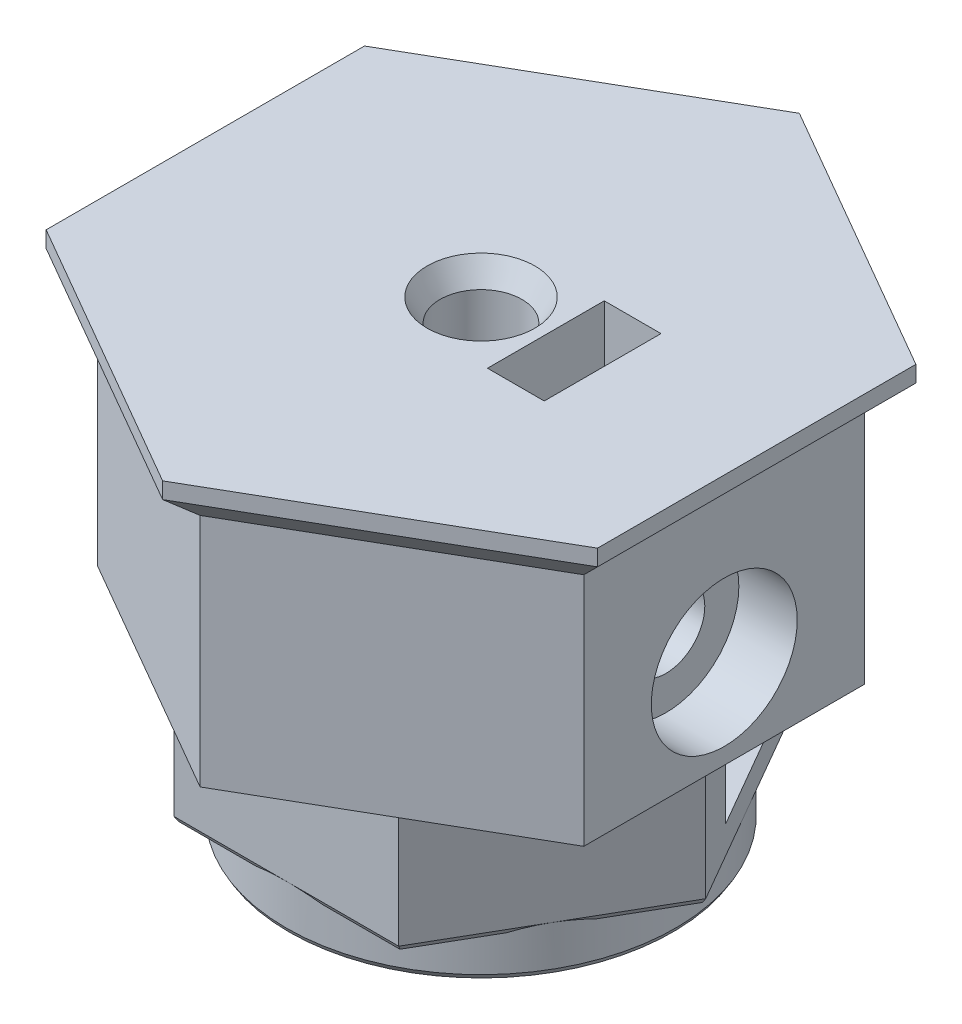
from build123d import *

# Parameters (mm, degrees)
SKIZZE1_R                       = 2.525
AUFSATZ_LINEAR_AUSTRAGEN1_DEPTH = 28
SKIZZE2_W                       = 3.5
SKIZZE2_H                       = 7.2
SCHNITT_LINEAR_AUSTRAGEN1_DEPTH = 16.2
SKIZZE4_R                       = 2.4
SCHNITT_LINEAR_AUSTRAGEN2_DEPTH = 16
SKIZZE6_R                       = 14.009035946
AUFSATZ_LINEAR_AUSTRAGEN3_DEPTH = 3
SKIZZE7_R                       = 20
SCHNITT_LINEAR_AUSTRAGEN4_DEPTH = 10.5
FASE1_SIZE                      = 0.8
FASE1_SIZE2                     = 1.385640646
SKIZZE9_W                       = 7.2
SKIZZE9_H                       = 3.5
SCHNITT_LINEAR_AUSTRAGEN5_DEPTH = 16
SKIZZE10_R                      = 8.5
SCHNITT_LINEAR_AUSTRAGEN6_DEPTH = 3
FASE2_SIZE                      = 2
SKIZZE11_R                      = 4.5
SCHNITT_LINEAR_AUSTRAGEN7_DEPTH = 3.6
SKIZZE12_R                      = 14.338361474
SKIZZE12_R_2                    = 12
SCHNITT_LINEAR_AUSTRAGEN8_DEPTH = 2.5
FASE3_SIZE                      = 0.3
FASE3_SIZE2                     = 0.173205081
FASE4_SIZE                      = 0.173205081
FASE4_SIZE_2                    = 0.3


# Some blends are built 0.0001 mm under size
with BuildPart() as part:
    # Skizze1 → Aufsatz-Linear austragen1 (new body)
    with BuildSketch(Plane(origin=(0, 0, 0), x_dir=(1, 0, 0), z_dir=(0, 1, 0))):
        Polygon((15, 8.660254038), (0, 17.320508076), (-15, 8.660254038), (-15, -8.660254038), (0, -17.320508076), (15, -8.660254038), align=None)
        with Locations(Location((0, 0, 0), (0, 0, 270))):
            Circle(SKIZZE1_R, mode=Mode.SUBTRACT)
    extrude(amount=AUFSATZ_LINEAR_AUSTRAGEN1_DEPTH)

    # Skizze2 → Schnitt-Linear austragen1 (cut)
    with BuildSketch(Plane(origin=(0, 28, 0), x_dir=(1, 0, 0), z_dir=(0, 1, 0))):
        with Locations((5.75, 0)):
            Rectangle(SKIZZE2_W, SKIZZE2_H)
    extrude(amount=-SCHNITT_LINEAR_AUSTRAGEN1_DEPTH, mode=Mode.SUBTRACT)

    # Skizze4 → Schnitt-Linear austragen2 (cut)
    with BuildSketch(Plane(origin=(15, 0, 0), x_dir=(0, 0, -1), z_dir=(1, 0, 0))):
        with Locations((0, 16)):
            Circle(SKIZZE4_R)
    extrude(amount=-SCHNITT_LINEAR_AUSTRAGEN2_DEPTH, mode=Mode.SUBTRACT)

    # Skizze6 → Aufsatz-Linear austragen3 (add)
    with BuildSketch(Plane(origin=(0, 28, 0), x_dir=(1, 0, 0), z_dir=(0, 1, 0))):
        Polygon((0, -19.629909152), (17, -9.814954576), (17, 9.814954576), (0, 19.629909152), (-17, 9.814954576), (-17, -9.814954576), align=None)
        Circle(SKIZZE6_R, mode=Mode.SUBTRACT)
    extrude(amount=-AUFSATZ_LINEAR_AUSTRAGEN3_DEPTH)

    # Skizze7 → Schnitt-Linear austragen4 (cut)
    with BuildSketch(Plane.XZ):
        Circle(SKIZZE7_R)
        Polygon((-6.92820323, 12), (-13.856406461, 0), (-6.92820323, -12), (6.92820323, -12), (13.856406461, 0), (6.92820323, 12), align=None, mode=Mode.SUBTRACT)
    extrude(amount=-SCHNITT_LINEAR_AUSTRAGEN4_DEPTH, mode=Mode.SUBTRACT)

    # Fase1
    fase1_edges = [part.edges().sort_by_distance(p)[0] for p in [
        (0, 28, -2.525),
    ]]
    fase1_side = [part.faces().sort_by_distance(p)[0] for p in [
        (0, 28, -3.044358579),
    ]]
    chamfer(fase1_edges, length=FASE1_SIZE, length2=FASE1_SIZE2, reference=fase1_side[0])

    # Skizze9 → Schnitt-Linear austragen5 (cut)
    with BuildSketch(Plane(origin=(10.392304845, 0, -6), x_dir=(-0.49999999999999983, 0, -0.8660254037844387), z_dir=(0.8660254037844387, 0, -0.49999999999999983))):
        with Locations((0, 6.25)):
            Rectangle(SKIZZE9_W, SKIZZE9_H)
    extrude(amount=-SCHNITT_LINEAR_AUSTRAGEN5_DEPTH, mode=Mode.SUBTRACT)

    # Skizze10 → Schnitt-Linear austragen6 (cut)
    with BuildSketch(Plane.XZ):
        with Locations(Location((0, 0, 0), (0, 0, 270))):
            Circle(SKIZZE10_R)
    extrude(amount=-SCHNITT_LINEAR_AUSTRAGEN6_DEPTH, mode=Mode.SUBTRACT)

    # Fase2
    fase2_edges = [part.edges().sort_by_distance(p)[0] for p in [
        (-8.5, 25, 14.722431864),
        (-17, 25, 0),
        (-8.5, 25, -14.722431864),
        (8.5, 25, -14.722431864),
        (17, 25, 0),
        (8.5, 25, 14.722431864),
    ]]
    chamfer(fase2_edges, length=FASE2_SIZE - 0.0001)  # a hair under: the kernel refuses the full size

    # Skizze11 → Schnitt-Linear austragen7 (cut)
    with BuildSketch(Plane(origin=(15, 0, 0), x_dir=(0, 0, -1), z_dir=(1, 0, 0))):
        with Locations((0, 16)):
            Circle(SKIZZE11_R)
    extrude(amount=-SCHNITT_LINEAR_AUSTRAGEN7_DEPTH, mode=Mode.SUBTRACT)

    # Skizze12 → Schnitt-Linear austragen8 (cut)
    with BuildSketch(Plane.XZ):
        Circle(SKIZZE12_R)
        with Locations(Location((0, 0, 0), (0, 0, 270))):
            Circle(SKIZZE12_R_2, mode=Mode.SUBTRACT)
    extrude(amount=-SCHNITT_LINEAR_AUSTRAGEN8_DEPTH, mode=Mode.SUBTRACT)

    # Fase3
    fase3_edges = [part.edges().sort_by_distance(p)[0] for p in [
        (0, 0, 12),
    ]]
    fase3_side = [part.faces().sort_by_distance(p)[0] for p in [
        (0, 1.25, 12),
    ]]
    chamfer(fase3_edges, length=FASE3_SIZE, length2=FASE3_SIZE2, reference=fase3_side[0])

    # Fase4
    # the kernel refuses this chamfer: 0.3, 0.173205081 mm, written as the material it takes off along each edge
    with BuildSketch(Plane(origin=(-10.392304845, 2.5, 6), x_dir=(0.864572857266567, -0.05789386240267096, -0.4991613718768963), z_dir=(0.5, 0, 0.8660254037844387))) as fase4_piece_1_section:
        Polygon((FASE4_SIZE * 0.998322742353, FASE4_SIZE * 0.0578938623214), (-FASE4_SIZE_2 * 0.0578938624027, FASE4_SIZE_2 * 0.998322743754), (0, 0), align=None)
    fase4_piece_1 = extrude(amount=7.704328957, mode=Mode.PRIVATE)
    fase4_piece_1 = fase4_piece_1 - Plane(origin=(0, 2.602492353, 0), x_dir=(0, 0, -1), z_dir=(0, -1, 0)) * Cylinder(12, 17, mode=Mode.PRIVATE)
    add(fase4_piece_1, mode=Mode.SUBTRACT)
    with BuildSketch(Plane(origin=(-14.244469324, 2.5, -0.672144596), x_dir=(0.864572857266567, -0.05789386240267102, -0.4991613718768963), z_dir=(0.5, 0, 0.8660254037844387))) as fase4_piece_2_section:
        Polygon((FASE4_SIZE * 0.998322742353, FASE4_SIZE * 0.0578938623214), (-FASE4_SIZE_2 * 0.0578938624027, FASE4_SIZE_2 * 0.998322743754), (0, 0), align=None)
    fase4_piece_2 = extrude(amount=7.704328957, mode=Mode.PRIVATE)
    fase4_piece_2 = fase4_piece_2 - Plane(origin=(0, 2.602492354, 0), x_dir=(0, 0, -1), z_dir=(0, -1, 0)) * Cylinder(12, 17, mode=Mode.PRIVATE)
    add(fase4_piece_2, mode=Mode.SUBTRACT)
    with BuildSketch(Plane(origin=(-7.704328957, 2.5, 12), x_dir=(0, -0.057893862402670936, -0.9983227437537926), z_dir=(1, 0, 0))) as fase4_piece_3_section:
        Polygon((FASE4_SIZE * 0.998322742353, FASE4_SIZE * 0.0578938623214), (-FASE4_SIZE_2 * 0.0578938624027, FASE4_SIZE_2 * 0.998322743754), (0, 0), align=None)
    fase4_piece_3 = extrude(amount=7.704328957, mode=Mode.PRIVATE)
    fase4_piece_3 = fase4_piece_3 - Plane(origin=(0, 2.602492354, 0), x_dir=(0, 0, -1), z_dir=(0, -1, 0)) * Cylinder(12, 17, mode=Mode.PRIVATE)
    add(fase4_piece_3, mode=Mode.SUBTRACT)
    with BuildSketch(Plane(origin=(0, 2.5, 12), x_dir=(0, -0.057893862402670936, -0.9983227437537926), z_dir=(1, 0, 0))) as fase4_piece_4_section:
        Polygon((FASE4_SIZE * 0.998322742353, FASE4_SIZE * 0.0578938623214), (-FASE4_SIZE_2 * 0.0578938624027, FASE4_SIZE_2 * 0.998322743754), (0, 0), align=None)
    fase4_piece_4 = extrude(amount=7.704328957, mode=Mode.PRIVATE)
    fase4_piece_4 = fase4_piece_4 - Plane(origin=(0, 2.602492353, 0), x_dir=(0, 0, -1), z_dir=(0, -1, 0)) * Cylinder(12, 17, mode=Mode.PRIVATE)
    add(fase4_piece_4, mode=Mode.SUBTRACT)
    with BuildSketch(Plane(origin=(6.540140367, 2.5, 12.672144596), x_dir=(-0.864572857266567, -0.05789386240267135, -0.49916137187689613), z_dir=(0.4999999999999999, 0, -0.8660254037844388))) as fase4_piece_5_section:
        Polygon((FASE4_SIZE * 0.998322742353, FASE4_SIZE * 0.0578938623214), (-FASE4_SIZE_2 * 0.0578938624027, FASE4_SIZE_2 * 0.998322743754), (0, 0), align=None)
    fase4_piece_5 = extrude(amount=7.704328957, mode=Mode.PRIVATE)
    fase4_piece_5 = fase4_piece_5 - Plane(origin=(0, 2.602492354, 0), x_dir=(0, 0, -1), z_dir=(0, -1, 0)) * Cylinder(12, 17, mode=Mode.PRIVATE)
    add(fase4_piece_5, mode=Mode.SUBTRACT)
    with BuildSketch(Plane(origin=(10.392304845, 2.5, 6), x_dir=(-0.864572857266567, -0.05789386240267096, -0.49916137187689613), z_dir=(0.4999999999999999, 0, -0.8660254037844388))) as fase4_piece_6_section:
        Polygon((FASE4_SIZE * 0.998322742353, FASE4_SIZE * 0.0578938623214), (-FASE4_SIZE_2 * 0.0578938624027, FASE4_SIZE_2 * 0.998322743754), (0, 0), align=None)
    fase4_piece_6 = extrude(amount=7.704328957, mode=Mode.PRIVATE)
    fase4_piece_6 = fase4_piece_6 - Plane(origin=(0, 2.602492353, 0), x_dir=(0, 0, -1), z_dir=(0, -1, 0)) * Cylinder(12, 17, mode=Mode.PRIVATE)
    add(fase4_piece_6, mode=Mode.SUBTRACT)
    with BuildSketch(Plane(origin=(14.244469324, 2.5, 0.672144596), x_dir=(-0.8645728572665671, -0.05789386240267102, 0.49916137187689597), z_dir=(-0.49999999999999967, 0, -0.8660254037844388))) as fase4_piece_7_section:
        Polygon((FASE4_SIZE * 0.998322742353, FASE4_SIZE * 0.0578938623214), (-FASE4_SIZE_2 * 0.0578938624027, FASE4_SIZE_2 * 0.998322743754), (0, 0), align=None)
    fase4_piece_7 = extrude(amount=7.704328957, mode=Mode.PRIVATE)
    fase4_piece_7 = fase4_piece_7 - Plane(origin=(0, 2.602492354, 0), x_dir=(0, 0, -1), z_dir=(0, -1, 0)) * Cylinder(12, 17, mode=Mode.PRIVATE)
    add(fase4_piece_7, mode=Mode.SUBTRACT)
    with BuildSketch(Plane(origin=(10.392304845, 2.5, -6), x_dir=(-0.8645728572665671, -0.05789386240267096, 0.499161371876896), z_dir=(-0.49999999999999967, 0, -0.8660254037844388))) as fase4_piece_8_section:
        Polygon((FASE4_SIZE * 0.998322742353, FASE4_SIZE * 0.0578938623214), (-FASE4_SIZE_2 * 0.0578938624027, FASE4_SIZE_2 * 0.998322743754), (0, 0), align=None)
    fase4_piece_8 = extrude(amount=7.704328957, mode=Mode.PRIVATE)
    fase4_piece_8 = fase4_piece_8 - Plane(origin=(0, 2.602492353, 0), x_dir=(0, 0, -1), z_dir=(0, -1, 0)) * Cylinder(12, 17, mode=Mode.PRIVATE)
    add(fase4_piece_8, mode=Mode.SUBTRACT)
    with BuildSketch(Plane(origin=(7.704328957, 2.5, -12), x_dir=(0, -0.057893862402670936, 0.9983227437537926), z_dir=(-1, 0, 0))) as fase4_piece_9_section:
        Polygon((FASE4_SIZE * 0.998322742353, FASE4_SIZE * 0.0578938623214), (-FASE4_SIZE_2 * 0.0578938624027, FASE4_SIZE_2 * 0.998322743754), (0, 0), align=None)
    fase4_piece_9 = extrude(amount=7.704328957, mode=Mode.PRIVATE)
    fase4_piece_9 = fase4_piece_9 - Plane(origin=(0, 2.602492354, 0), x_dir=(0, 0, -1), z_dir=(0, -1, 0)) * Cylinder(12, 17, mode=Mode.PRIVATE)
    add(fase4_piece_9, mode=Mode.SUBTRACT)
    with BuildSketch(Plane(origin=(0, 2.5, -12), x_dir=(0, -0.057893862402670936, 0.9983227437537926), z_dir=(-1, 0, 0))) as fase4_piece_10_section:
        Polygon((FASE4_SIZE * 0.998322742353, FASE4_SIZE * 0.0578938623214), (-FASE4_SIZE_2 * 0.0578938624027, FASE4_SIZE_2 * 0.998322743754), (0, 0), align=None)
    fase4_piece_10 = extrude(amount=7.704328957, mode=Mode.PRIVATE)
    fase4_piece_10 = fase4_piece_10 - Plane(origin=(0, 2.602492354, 0), x_dir=(0, 0, -1), z_dir=(0, -1, 0)) * Cylinder(12, 17, mode=Mode.PRIVATE)
    add(fase4_piece_10, mode=Mode.SUBTRACT)
    with BuildSketch(Plane(origin=(-6.540140367, 2.5, -12.672144596), x_dir=(0.864572857266567, -0.05789386240267136, 0.49916137187689624), z_dir=(-0.4999999999999999, 0, 0.8660254037844387))) as fase4_piece_11_section:
        Polygon((FASE4_SIZE * 0.998322742353, FASE4_SIZE * 0.0578938623214), (-FASE4_SIZE_2 * 0.0578938624027, FASE4_SIZE_2 * 0.998322743754), (0, 0), align=None)
    fase4_piece_11 = extrude(amount=7.704328957, mode=Mode.PRIVATE)
    fase4_piece_11 = fase4_piece_11 - Plane(origin=(0, 2.602492354, 0), x_dir=(0, 0, -1), z_dir=(0, -1, 0)) * Cylinder(12, 17, mode=Mode.PRIVATE)
    add(fase4_piece_11, mode=Mode.SUBTRACT)
    with BuildSketch(Plane(origin=(-10.392304845, 2.5, -6), x_dir=(0.864572857266567, -0.05789386240267096, 0.49916137187689624), z_dir=(-0.4999999999999999, 0, 0.8660254037844387))) as fase4_piece_12_section:
        Polygon((FASE4_SIZE * 0.998322742353, FASE4_SIZE * 0.0578938623214), (-FASE4_SIZE_2 * 0.0578938624027, FASE4_SIZE_2 * 0.998322743754), (0, 0), align=None)
    fase4_piece_12 = extrude(amount=7.704328957, mode=Mode.PRIVATE)
    fase4_piece_12 = fase4_piece_12 - Plane(origin=(0, 2.602492353, 0), x_dir=(0, 0, -1), z_dir=(0, -1, 0)) * Cylinder(12, 17, mode=Mode.PRIVATE)
    add(fase4_piece_12, mode=Mode.SUBTRACT)


solid = part.part
